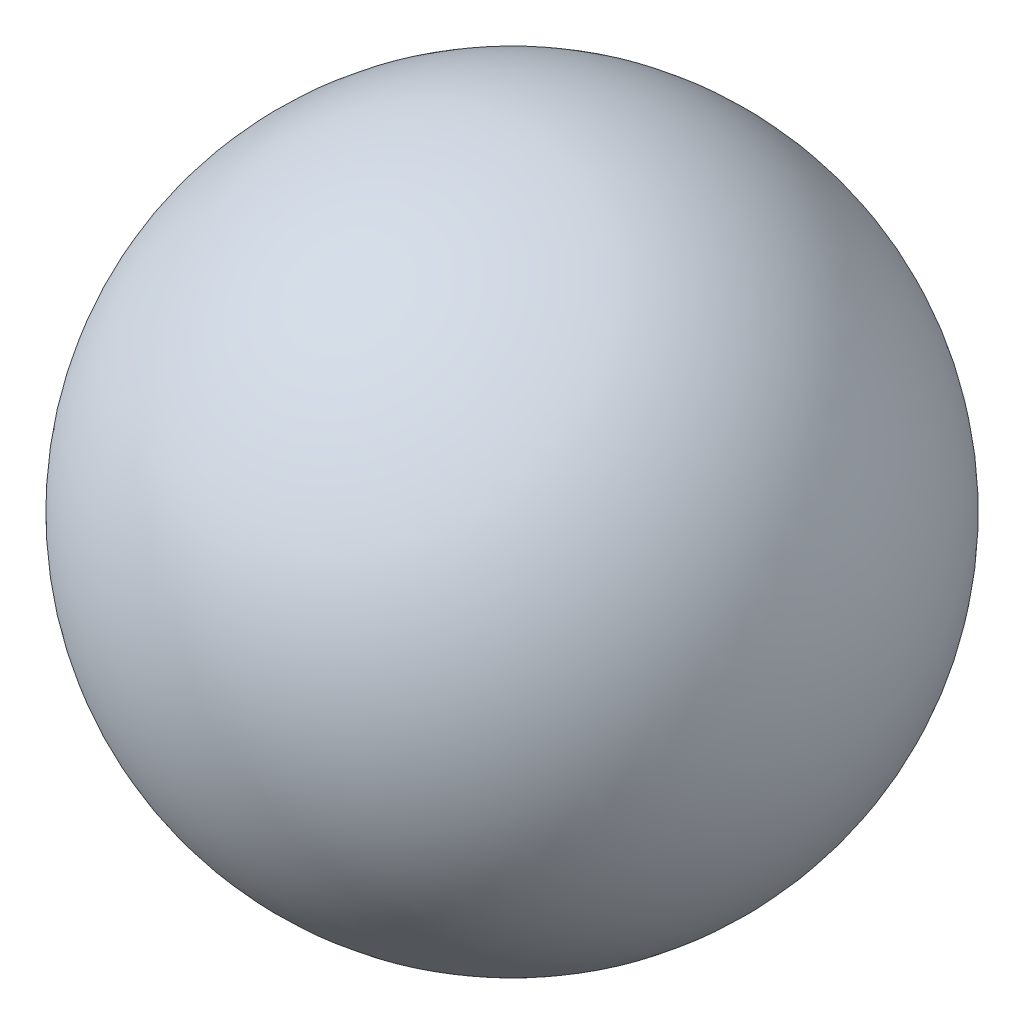
from build123d import *


with BuildPart() as part:
    # Esquisse1 → Révolution3 (revolve)
    with BuildSketch(Plane.XY):
        with BuildLine():
            Line((0, 20), (0, -20))
            ThreePointArc((0, -20), (20, 0), (0, 20))
        make_face()
    revolve(axis=Axis((0, 20, 0), (0, -1, 0)))


solid = part.part
